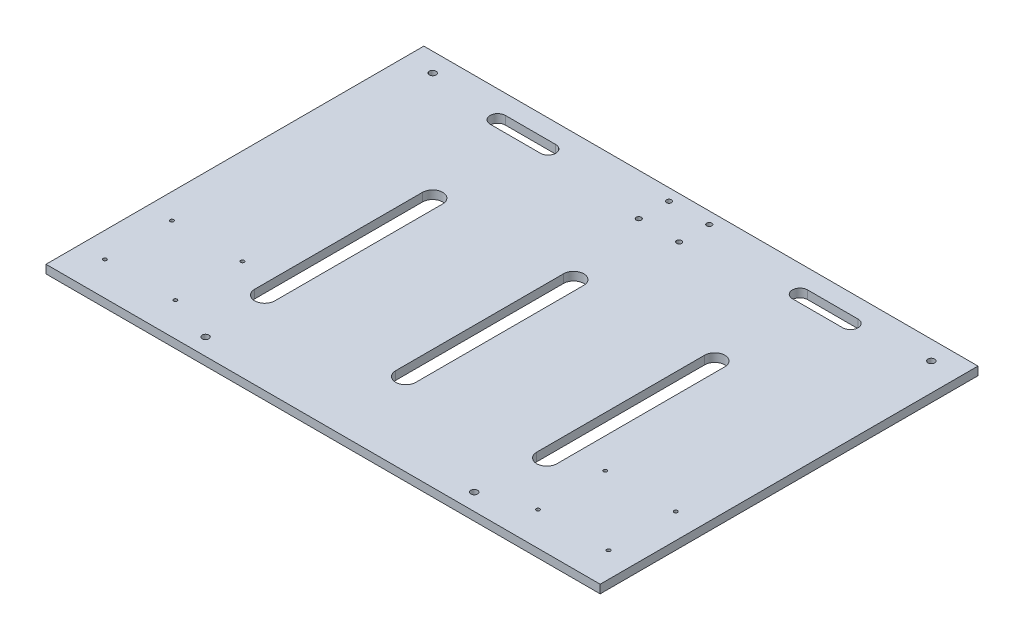
from build123d import *

# Parameters (mm, degrees)
SKETCH_1_W          = 330
SKETCH_1_H          = 225
EXTRUDE_1_DEPTH     = 5
SKETCH_2_R          = 1.515
CUT_EXTRUDE_1_DEPTH = 395.101001153
SKETCH_3_R          = 1.05
CUT_EXTRUDE_2_DEPTH = 395.101001153
CUT_EXTRUDE_4_DEPTH = 395.101001153
SKETCH_6_R          = 2
CUT_EXTRUDE_5_DEPTH = 395.101001153


with BuildPart() as part:
    # 草图1 → 凸台-拉伸1 (new body)
    with BuildSketch(Plane(origin=(0, 0, 0), x_dir=(1, 0, 0), z_dir=(0, 1, 0))):
        with Locations((149.701456311, 124.678398058)):
            Rectangle(SKETCH_1_W, SKETCH_1_H)
    extrude(amount=EXTRUDE_1_DEPTH)

    # 草图2 → 切除-拉伸1 (cut, through all)
    with BuildSketch(Plane(origin=(0, 5, 0), x_dir=(1, 0, 0), z_dir=(0, 1, 0))):
        with Locations((137.701456311, 230.178398058)):
            Circle(SKETCH_2_R)
        with Locations((161.701456311, 230.178398058)):
            Circle(SKETCH_2_R)
        with Locations((137.701456311, 212.178398058)):
            Circle(SKETCH_2_R)
        with Locations((161.701456311, 212.178398058)):
            Circle(SKETCH_2_R)
        with BuildLine():
            Line((44.701456311, 225.715369926), (74.701456311, 225.715369926))
            ThreePointArc((74.701456311, 225.715369926), (79.238428179, 221.178398058), (74.701456311, 216.64142619))
            Line((74.701456311, 216.64142619), (44.701456311, 216.64142619))
            ThreePointArc((44.701456311, 216.64142619), (40.164484443, 221.178398058), (44.701456311, 225.715369926))
        make_face()
        with BuildLine():
            Line((254.701456311, 225.715369926), (224.701456311, 225.715369926))
            ThreePointArc((224.701456311, 225.715369926), (220.164484443, 221.178398058), (224.701456311, 216.64142619))
            Line((224.701456311, 216.64142619), (254.701456311, 216.64142619))
            ThreePointArc((254.701456311, 216.64142619), (259.238428179, 221.178398058), (254.701456311, 225.715369926))
        make_face()
    extrude(amount=-CUT_EXTRUDE_1_DEPTH, mode=Mode.SUBTRACT)

    # 草图3 → 切除-拉伸2 (cut, through all)
    with BuildSketch(Plane(origin=(0, 5, 0), x_dir=(1, 0, 0), z_dir=(0, 1, 0))):
        with Locations((-0.298543689, 32.178398058)):
            Circle(SKETCH_3_R)
        with Locations((-0.298543689, 72.178398058)):
            Circle(SKETCH_3_R)
        with Locations((41.701456311, 32.178398058)):
            Circle(SKETCH_3_R)
        with Locations((41.701456311, 72.178398058)):
            Circle(SKETCH_3_R)
        with Locations((257.701456311, 72.178398058)):
            Circle(SKETCH_3_R)
        with Locations((257.701456311, 32.178398058)):
            Circle(SKETCH_3_R)
        with Locations((299.701456311, 72.178398058)):
            Circle(SKETCH_3_R)
        with Locations((299.701456311, 32.178398058)):
            Circle(SKETCH_3_R)
    extrude(amount=-CUT_EXTRUDE_2_DEPTH, mode=Mode.SUBTRACT)

    # 草图5 → 切除-拉伸4 (cut, through all)
    with BuildSketch(Plane(origin=(0, 5, 0), x_dir=(1, 0, 0), z_dir=(0, 1, 0))):
        with BuildLine():
            Line((155.701456311, 161.411602286), (155.701456311, 61.411602286))
            ThreePointArc((155.701456311, 61.411602286), (149.701456311, 55.411602286), (143.701456311, 61.411602286))
            Line((143.701456311, 61.411602286), (143.701456311, 161.411602286))
            ThreePointArc((143.701456311, 161.411602286), (149.701456311, 167.411602286), (155.701456311, 161.411602286))
        make_face()
        with BuildLine():
            Line((239.701456311, 161.411602286), (239.701456311, 61.411602286))
            ThreePointArc((239.701456311, 61.411602286), (233.701456311, 55.411602286), (227.701456311, 61.411602286))
            Line((227.701456311, 61.411602286), (227.701456311, 161.411602286))
            ThreePointArc((227.701456311, 161.411602286), (233.701456311, 167.411602286), (239.701456311, 161.411602286))
        make_face()
        with BuildLine():
            Line((59.701456311, 161.411602286), (59.701456311, 61.411602286))
            ThreePointArc((59.701456311, 61.411602286), (65.701456311, 55.411602286), (71.701456311, 61.411602286))
            Line((71.701456311, 61.411602286), (71.701456311, 161.411602286))
            ThreePointArc((71.701456311, 161.411602286), (65.701456311, 167.411602286), (59.701456311, 161.411602286))
        make_face()
    extrude(amount=-CUT_EXTRUDE_4_DEPTH, mode=Mode.SUBTRACT)

    # 草图6 → 切除-拉伸5 (cut, through all)
    with BuildSketch(Plane(origin=(0, 5, 0), x_dir=(1, 0, 0), z_dir=(0, 1, 0))):
        with Locations((1.226003167, 225.911661565)):
            Circle(SKETCH_6_R)
        with Locations((298.176909455, 225.911661565)):
            Circle(SKETCH_6_R)
        with Locations((69.701456311, 22.178398058)):
            Circle(SKETCH_6_R)
        with Locations((229.701456311, 22.178398058)):
            Circle(SKETCH_6_R)
    extrude(amount=-CUT_EXTRUDE_5_DEPTH, mode=Mode.SUBTRACT)


solid = part.part
